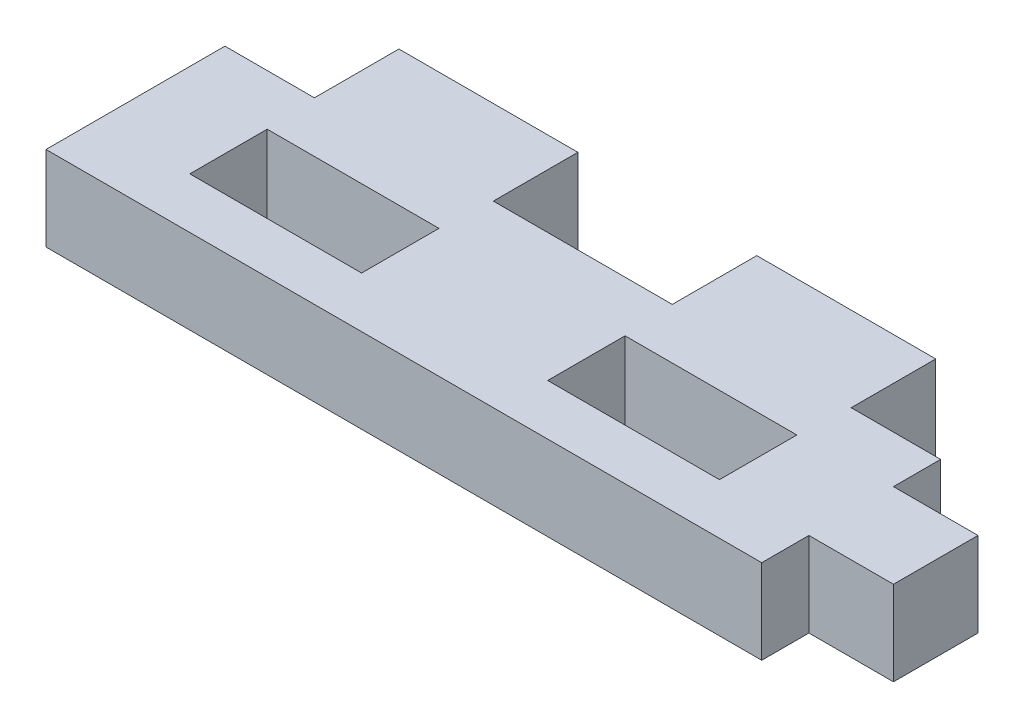
from build123d import *

# Parameters (mm, degrees)
SKETCH1_W           = 6.096
SKETCH1_H           = 2.746000096
BOSS_EXTRUDE1_DEPTH = 1.5


with BuildPart() as part:
    # Sketch1 → Boss-Extrude1 (new, symmetric)
    with BuildSketch(Plane(origin=(0, 0, 0), x_dir=(1, 0, 0), z_dir=(0, 1, 0))):
        Polygon((3.175, 3.175), (6.35, 3.175), (6.35, 1.5), (9.35, 1.5), (9.35, -1.5), (6.35, -1.5), (6.35, -3.175), (-6.35, -3.175), (-19.05, -3.175), (-19.05, 3.175), (-15.875, 3.175), (-15.875, 6.175), (-9.525, 6.175), (-9.525, 3.175), (-6.35, 3.175), (-3.175, 3.175), (-3.175, 6.175), (3.175, 6.175), align=None)
        Rectangle(SKETCH1_W, SKETCH1_H, mode=Mode.SUBTRACT)
        with Locations((-12.7, 0)):
            Rectangle(SKETCH1_W, SKETCH1_H, mode=Mode.SUBTRACT)
    extrude(amount=BOSS_EXTRUDE1_DEPTH, both=True)


solid = part.part
